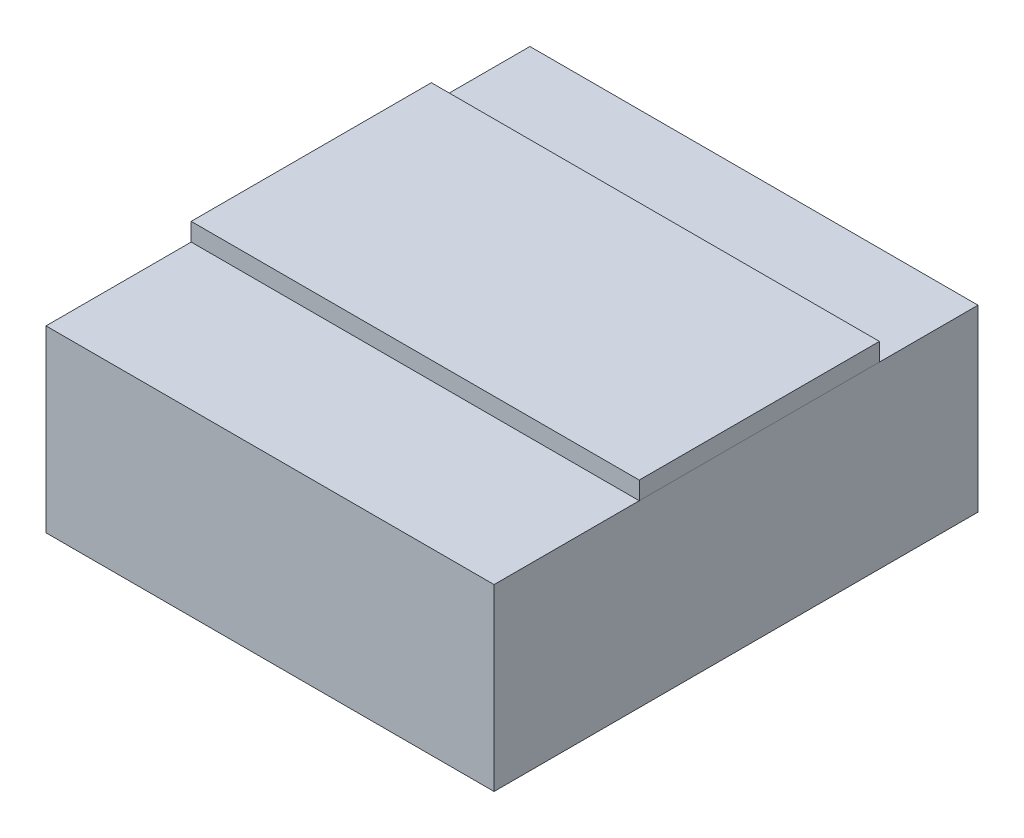
from build123d import *

# Parameters (mm, degrees)
SKETCH1_W           = 25
SKETCH1_H           = 27
BOSS_EXTRUDE1_DEPTH = 10
SKETCH2_W           = 25
SKETCH2_H           = 13.4
BOSS_EXTRUDE2_DEPTH = 1


with BuildPart() as part:
    # Sketch1 → Boss-Extrude1 (new body)
    with BuildSketch(Plane(origin=(0, 0, 0), x_dir=(1, 0, 0), z_dir=(0, 1, 0))):
        with Locations((64.659126964, -28.384601034)):
            Rectangle(SKETCH1_W, SKETCH1_H)
    extrude(amount=BOSS_EXTRUDE1_DEPTH)


with BuildPart() as body_2:
    # Sketch2 → Boss-Extrude2 (new body)
    with BuildSketch(Plane(origin=(0, 10, 0), x_dir=(1, 0, 0), z_dir=(0, 1, 0))):
        with Locations((64.659126964, -27.084601034)):
            Rectangle(SKETCH2_W, SKETCH2_H)
    extrude(amount=BOSS_EXTRUDE2_DEPTH)


solid = Compound([part.part, body_2.part])
